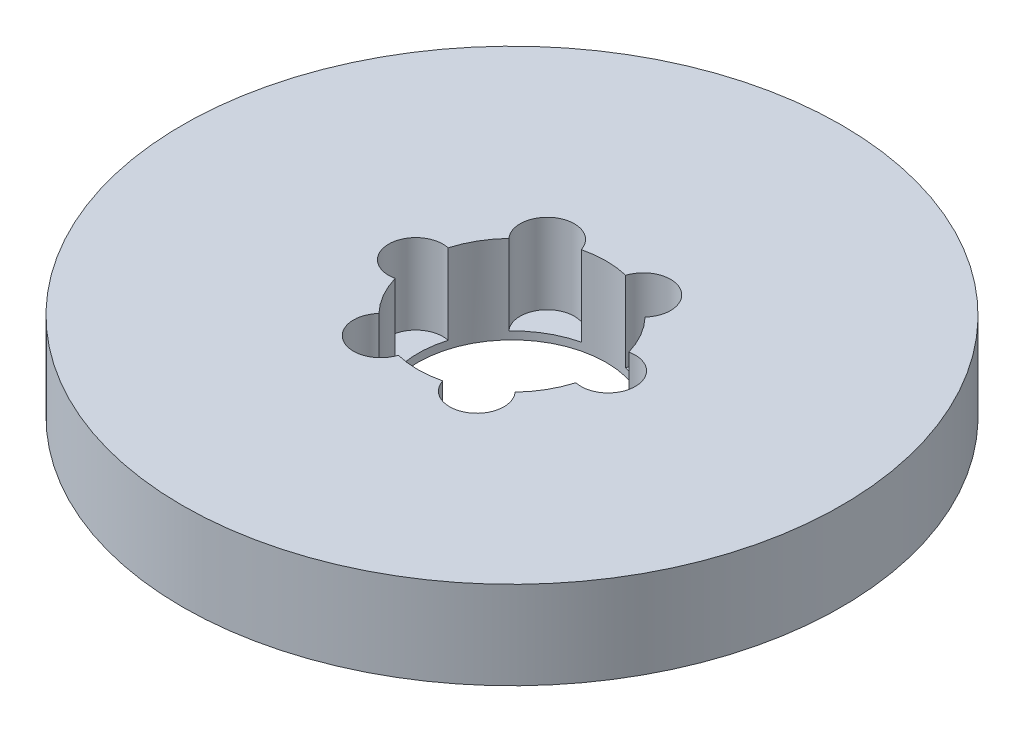
from build123d import *

# Parameters (mm, degrees)
SKETCH1_R           = 52.5
BOSS_EXTRUDE1_DEPTH = 14
SKETCH2_R           = 15
CUT_EXTRUDE1_DEPTH  = 76.554616007
SKETCH3_R           = 4.322850115
CUT_EXTRUDE2_DEPTH  = 12.759756833
CIRPATTERN1_COUNT   = 6


with BuildPart() as part:
    # Sketch1 → Boss-Extrude1 (new body)
    with BuildSketch(Plane(origin=(0, 0, 0), x_dir=(1, 0, 0), z_dir=(0, 1, 0))):
        Circle(SKETCH1_R)
    extrude(amount=BOSS_EXTRUDE1_DEPTH)

    # Sketch2 → Cut-Extrude1 (cut, through all)
    with BuildSketch(Plane(origin=(0, 0, 0), x_dir=(1, 0, 0), z_dir=(0, 1, 0))):
        Circle(SKETCH2_R)
    extrude(amount=CUT_EXTRUDE1_DEPTH, mode=Mode.SUBTRACT)

    # Sketch3 → Cut-Extrude2 (cut)
    with BuildSketch(Plane(origin=(0, 14, 0), x_dir=(1, 0, 0), z_dir=(0, 1, 0))):
        with Locations((-15.324071518, 0)):
            Circle(SKETCH3_R)
    cut_extrude2 = extrude(amount=-CUT_EXTRUDE2_DEPTH, mode=Mode.SUBTRACT)

    # CirPattern1: Cut-Extrude2 ×6 about axis
    cirpattern1_axis = Axis((0, 0, 0), (0, 1, 0))
    for i in range(1, CIRPATTERN1_COUNT):
        add(cut_extrude2.rotate(cirpattern1_axis, i * 360 / CIRPATTERN1_COUNT), mode=Mode.SUBTRACT)


solid = part.part
